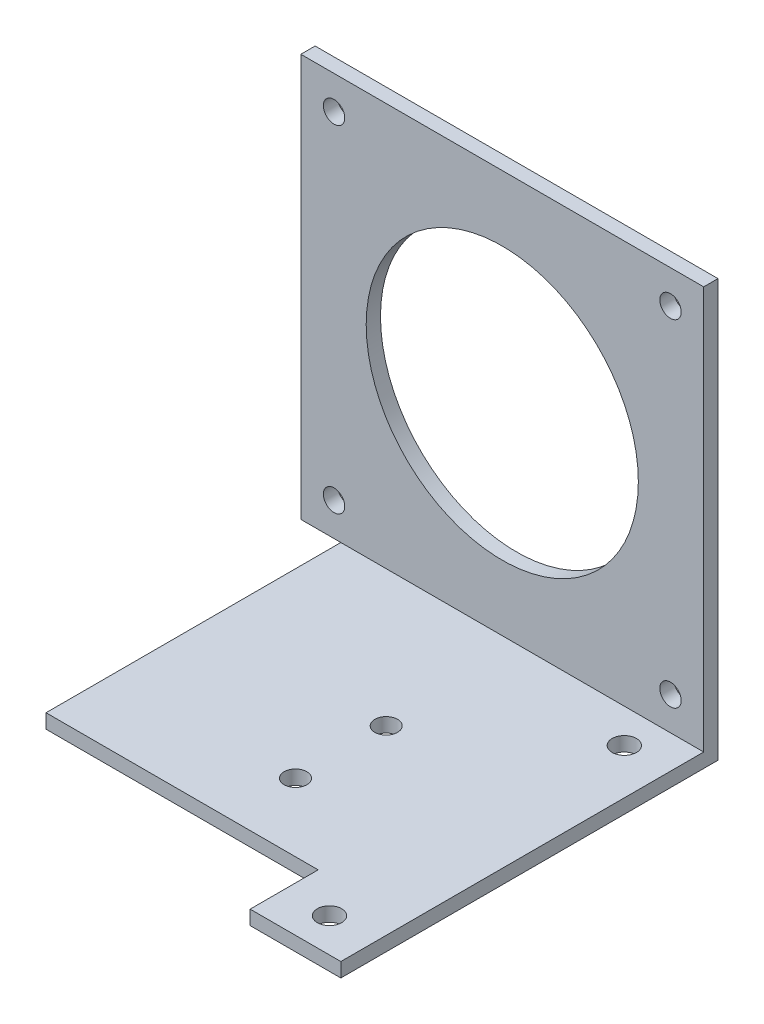
from build123d import *

# Parameters (mm, degrees)
SKETCH1_R           = 1.7
SKETCH1_R_2         = 1.5875
BOSS_EXTRUDE1_DEPTH = 2
SKETCH2_W           = 56.4
SKETCH2_H           = 2
BOSS_EXTRUDE2_DEPTH = 56.4
SKETCH3_R           = 19.05
SKETCH3_R_2         = 1.5
CUT_EXTRUDE1_DEPTH  = 85.613237735


with BuildPart() as part:
    # Sketch1 → Boss-Extrude1 (new body)
    with BuildSketch(Plane(origin=(0, 0, 0), x_dir=(1, 0, 0), z_dir=(0, 1, 0))):
        Polygon((-25.4, 27.4), (25.4, 27.4), (25.4, -25.4), (12.7, -25.4), (12.7, -15.875), (-25.4, -15.875), align=None)
        with Locations((19.05, 20.6375)):
            Circle(SKETCH1_R, mode=Mode.SUBTRACT)
        with Locations((19.05, -20.6375)):
            Circle(SKETCH1_R, mode=Mode.SUBTRACT)
        with Locations((0, 6.35)):
            Circle(SKETCH1_R_2, mode=Mode.SUBTRACT)
        with Locations((0, -6.35)):
            Circle(SKETCH1_R_2, mode=Mode.SUBTRACT)
    extrude(amount=BOSS_EXTRUDE1_DEPTH)

    # Sketch2 → Boss-Extrude2 (add)
    with BuildSketch(Plane(origin=(0, 2, 0), x_dir=(1, 0, 0), z_dir=(0, 1, 0))):
        with Locations((-2.8, 26.4)):
            Rectangle(SKETCH2_W, SKETCH2_H)
    extrude(amount=BOSS_EXTRUDE2_DEPTH)

    # Sketch3 → Cut-Extrude1 (cut, through all)
    with BuildSketch(Plane(origin=(0, 0, -27.4), x_dir=(-1, 0, 0), z_dir=(0, 0, -1))):
        with Locations((2.8, 30.2)):
            Circle(SKETCH3_R)
        with Locations((26.35, 53.75)):
            Circle(SKETCH3_R_2)
        with Locations((26.35, 6.65)):
            Circle(SKETCH3_R_2)
        with Locations((-20.75, 6.65)):
            Circle(SKETCH3_R_2)
        with Locations((-20.75, 53.75)):
            Circle(SKETCH3_R_2)
    extrude(amount=-CUT_EXTRUDE1_DEPTH, mode=Mode.SUBTRACT)


solid = part.part
